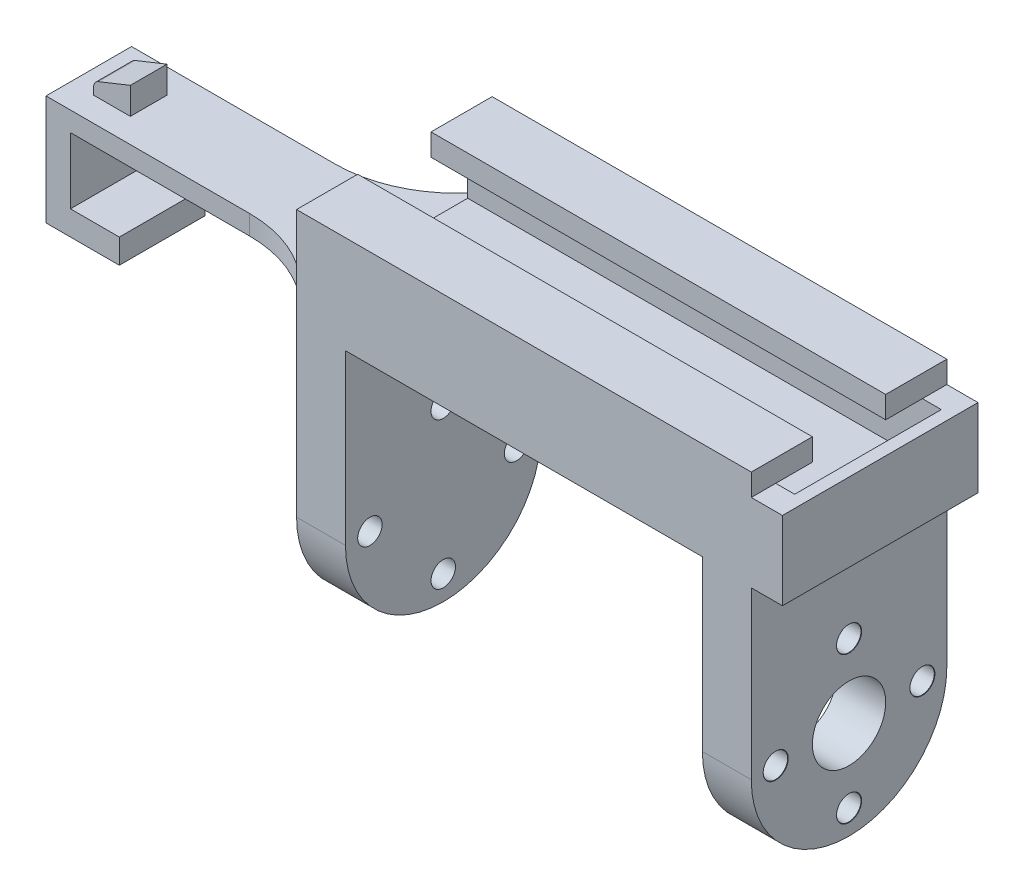
from build123d import *

# Parameters (mm, degrees)
BOSS_EXTRUDE1_DEPTH             = 8
BOSS_EXTRUDE1_DEPTH_BACK        = 8
M1_6_CLEARANCE_HOLE1_AT_2_COUNT = 2
M1_6_CLEARANCE_HOLE1_AT_2_PITCH = 8.485281374
M1_6_CLEARANCE_HOLE1_AT_3_COUNT = 2
M1_6_CLEARANCE_HOLE1_AT_3_PITCH = 12
M1_6_CLEARANCE_HOLE1_AT_4_COUNT = 2
M1_6_CLEARANCE_HOLE1_AT_4_PITCH = 8.485281374
CUT_EXTRUDE1_DEPTH              = 43.093229859
CUT_EXTRUDE1_DEPTH_BACK         = 43.093229859
CUT_EXTRUDE2_DEPTH              = 43.093229859
CUT_EXTRUDE2_DEPTH_BACK         = 43.093229859
SKETCH6_W                       = 6
SKETCH6_H                       = 1.8
SKETCH6_W_2                     = 12
SKETCH6_H_2                     = 4.4
BOSS_EXTRUDE2_START             = -0.5
SKETCH8_W                       = 23
SKETCH8_H                       = 7
BOSS_EXTRUDE2_DEPTH             = 1.6
BOSS_EXTRUDE3_DEPTH             = 7
BOSS_EXTRUDE4_DEPTH             = 1.55
SKETCH13_W                      = 16
SKETCH13_H                      = 6.4
BOSS_EXTRUDE5_DEPTH             = 1
BOSS_EXTRUDE6_DEPTH             = 1.5
BOSS_EXTRUDE6_DEPTH_BACK        = 1.5
FILLET1_R                       = 0.6
FILLET2_R                       = 10
FILLET3_R                       = 3
CUT_EXTRUDE3_DEPTH              = 66.244463379
CUT_EXTRUDE3_DEPTH_BACK         = 10
SKETCH16_R                      = 3


with BuildPart() as part:
    # Sketch1 → Boss-Extrude1 (new, two sides: drawn at the far end of the back side and taken through both)
    with BuildSketch(Plane.XY.offset(-BOSS_EXTRUDE1_DEPTH_BACK)):
        Polygon((18.6, 18), (-18.6, 18), (-18.6, -18), (-14.6, -18), (-14.6, 10), (14.6, 10), (14.6, -18), (18.6, -18), align=None)
    extrude(amount=BOSS_EXTRUDE1_DEPTH + BOSS_EXTRUDE1_DEPTH_BACK)

    # Sketch4 → M1.6 Clearance Hole1 (revolve, cut)
    with BuildSketch(Plane(origin=(18.6, -3.8, 6), x_dir=(0, 0, -1), z_dir=(0, 1, 0))):
        Polygon((0, 0), (0, 4.600860619), (1, 4), (1, 0.025), (1.025, 0), align=None)
    m1_6_clearance_hole1 = revolve(axis=Axis((24.95, -3.8, 6), (-1, 0, 0)), mode=Mode.SUBTRACT)

    # M1.6 Clearance Hole1 at 2: M1.6 Clearance Hole1 ×2
    with Locations(*[Vector(0, 0.7071067811865476, -0.7071067811865476) * (i * M1_6_CLEARANCE_HOLE1_AT_2_PITCH) for i in range(1, M1_6_CLEARANCE_HOLE1_AT_2_COUNT)]):
        add(m1_6_clearance_hole1, mode=Mode.SUBTRACT)

    # M1.6 Clearance Hole1 at 3: M1.6 Clearance Hole1 ×2
    with Locations(*[(0, 0, -i * M1_6_CLEARANCE_HOLE1_AT_3_PITCH) for i in range(1, M1_6_CLEARANCE_HOLE1_AT_3_COUNT)]):
        add(m1_6_clearance_hole1, mode=Mode.SUBTRACT)

    # M1.6 Clearance Hole1 at 4: M1.6 Clearance Hole1 ×2
    with Locations(*[Vector(0, -0.7071067811865475, -0.7071067811865476) * (i * M1_6_CLEARANCE_HOLE1_AT_4_PITCH) for i in range(1, M1_6_CLEARANCE_HOLE1_AT_4_COUNT)]):
        add(m1_6_clearance_hole1, mode=Mode.SUBTRACT)

    # Mirror1: M1.6 Clearance Hole1 across plane
    add(m1_6_clearance_hole1.mirror(Plane(origin=(0, 0, 0), x_dir=(0, 0, 1), z_dir=(1, 0, 0))), mode=Mode.SUBTRACT)

    # Mirror1 copy 1 sketch → Mirror1 copy 1 (revolve, cut)
    with BuildSketch(Plane(origin=(-18.6, 2.2, 0), x_dir=(0, 0, -1), z_dir=(0, 1, 0))):
        Polygon((0, 0), (0, -4.600860619), (1, -4), (1, -0.025), (1.025, 0), align=None)
    revolve(axis=Axis((-24.95, 2.2, 0), (-1, 0, 0)), mode=Mode.SUBTRACT)

    # Mirror1 copy 2 sketch → Mirror1 copy 2 (revolve, cut)
    with BuildSketch(Plane(origin=(-18.6, -3.8, -6), x_dir=(0, 0, -1), z_dir=(0, 1, 0))):
        Polygon((0, 0), (0, -4.600860619), (1, -4), (1, -0.025), (1.025, 0), align=None)
    revolve(axis=Axis((-24.95, -3.8, -6), (-1, 0, 0)), mode=Mode.SUBTRACT)

    # Mirror1 copy 3 sketch → Mirror1 copy 3 (revolve, cut)
    with BuildSketch(Plane(origin=(-18.6, -9.8, 0), x_dir=(0, 0, -1), z_dir=(0, 1, 0))):
        Polygon((0, 0), (0, -4.600860619), (1, -4), (1, -0.025), (1.025, 0), align=None)
    revolve(axis=Axis((-24.95, -9.8, 0), (-1, 0, 0)), mode=Mode.SUBTRACT)

    # Sketch5 → Cut-Extrude1 (cut, two sides: drawn at the far end of the back side and taken through both)
    with BuildSketch(Plane(origin=(18.6, 0, 0), x_dir=(0, 0, -1), z_dir=(1, 0, 0)).offset(-CUT_EXTRUDE1_DEPTH_BACK)):
        with BuildLine():
            Line((-8, -3.8), (-8, -18))
            Line((-8, -18), (8, -18))
            Line((8, -18), (8, -3.8))
            ThreePointArc((8, -3.8), (0, -11.8), (-8, -3.8))
        make_face()
    extrude(amount=CUT_EXTRUDE1_DEPTH + CUT_EXTRUDE1_DEPTH_BACK, mode=Mode.SUBTRACT)

    # Sketch6 → Cut-Extrude2 (cut, two sides: drawn at the far end of the back side and taken through both)
    with BuildSketch(Plane.ZY.offset(18.6).offset(-CUT_EXTRUDE2_DEPTH_BACK)):
        with Locations((0, 17.1)):
            Rectangle(SKETCH6_W, SKETCH6_H)
        with Locations((0, 14)):
            Rectangle(SKETCH6_W_2, SKETCH6_H_2)
    extrude(amount=CUT_EXTRUDE2_DEPTH + CUT_EXTRUDE2_DEPTH_BACK, mode=Mode.SUBTRACT)

    # Sketch8 → Boss-Extrude2 (add)
    with BuildSketch(Plane(origin=(0, 11.8, 0), x_dir=(1, 0, 0), z_dir=(0, 1, 0)).offset(BOSS_EXTRUDE2_START)):
        with Locations((-30.1, 0)):
            Rectangle(SKETCH8_W, SKETCH8_H)
    extrude(amount=-BOSS_EXTRUDE2_DEPTH)

    # Sketch10 → Boss-Extrude3 (add)
    with BuildSketch(Plane.XY.offset(3.5)):
        Polygon((-41.6, 11.3), (-43.6, 11.3), (-43.6, 2.3), (-37.6, 2.3), (-37.6, 4.3), (-41.6, 4.3), align=None)
    extrude(amount=-BOSS_EXTRUDE3_DEPTH)

    # Sketch12 → Boss-Extrude4 (add)
    with BuildSketch(Plane(origin=(18.6, 0, 0), x_dir=(0, 0, -1), z_dir=(1, 0, 0))):
        Polygon((6, 11.8), (6, 16.2), (8, 16.2), (8, 9.8), (-8, 9.8), (-8, 16.2), (-6, 16.2), (-6, 11.8), align=None)
    extrude(amount=BOSS_EXTRUDE4_DEPTH)

    # Sketch13 → Boss-Extrude5 (add)
    with BuildSketch(Plane(origin=(20.15, 0, 0), x_dir=(0, 0, -1), z_dir=(1, 0, 0))):
        with Locations((0, 13)):
            Rectangle(SKETCH13_W, SKETCH13_H)
    extrude(amount=BOSS_EXTRUDE5_DEPTH)

    # Sketch14 → Boss-Extrude6 (add, two sides: drawn at the far end of the back side and taken through both)
    with BuildSketch(Plane.XY.offset(-BOSS_EXTRUDE6_DEPTH_BACK)):
        Polygon((-41.7, 11.3), (-41.7, 12.3), (-38.7, 13.5), (-38.7, 11.3), align=None)
    extrude(amount=BOSS_EXTRUDE6_DEPTH + BOSS_EXTRUDE6_DEPTH_BACK)

    # Fillet1
    fillet1_edges = [part.edges().sort_by_distance(p)[0] for p in [
        (-41.7, 12.3, 0),
    ]]
    fillet(fillet1_edges, radius=FILLET1_R)

    # Fillet2
    # the kernel refuses this fillet: 10 mm, written as the material it adds along each edge
    with BuildSketch(Plane(origin=(-18.6, 11.3, -3.5), x_dir=(-1.5292458657399207e-12, 0, -1.0), z_dir=(0, -1, 0))) as fillet2_piece_1:
        with BuildLine():
            CenterArc((10, -8.351646544), FILLET2_R, 123.367012969, 56.632987031)
            Line((0, -8.351646544), (0, 0))
            Line((0, 0), (4.5, 0))
        make_face()
    extrude(amount=1.6)
    with BuildSketch(Plane(origin=(-18.6, 11.3, 3.5), x_dir=(-1, 0, 0), z_dir=(0, -1, 0))) as fillet2_piece_2:
        with BuildLine():
            CenterArc((8.351646544, -10), FILLET2_R, 90, 56.632987031)
            Line((0, -4.5), (0, 0))
            Line((0, 0), (8.351646544, 0))
        make_face()
    extrude(amount=1.6)

    # Fillet3
    # the kernel refuses this fillet: 3 mm, written as the material it adds along each edge
    with BuildSketch(Plane(origin=(-18.6, 9.7, 3.5), x_dir=(-1, 0, 0), z_dir=(0, 0, -1))) as fillet3_piece_1:
        with BuildLine():
            CenterArc((FILLET3_R, -FILLET3_R), FILLET3_R, 90, 90)
            Line((0, -FILLET3_R), (0, 0))
            Line((0, 0), (FILLET3_R, 0))
        make_face()
    extrude(amount=7)
    with BuildSketch(Plane(origin=(-18.6, 9.7, 8), x_dir=(-1.0, 0, -1.5555555555538275e-12), z_dir=(1.5555555555538273e-12, 0, -1.0))) as fillet3_piece_2_section:
        with BuildLine():
            CenterArc((FILLET3_R, -FILLET3_R), FILLET3_R, 90, 90)
            Line((0, -FILLET3_R), (0, 0))
            Line((0, 0), (FILLET3_R, 0))
        make_face()
    fillet3_piece_2 = extrude(amount=4.5, mode=Mode.PRIVATE)
    fillet3_piece_2 = fillet3_piece_2 - Plane(origin=(-26.951646544, 8.943750406, 13.5), x_dir=(-1, 0, 0), z_dir=(0, 1, 0)) * Cylinder(10, 22, mode=Mode.PRIVATE)
    add(fillet3_piece_2)
    with BuildSketch(Plane(origin=(-18.6, 9.7, -3.5), x_dir=(-1.0, 0, 2e-12), z_dir=(-2e-12, 0, -1.0))) as fillet3_piece_3_section:
        with BuildLine():
            CenterArc((FILLET3_R, -FILLET3_R), FILLET3_R, 90, 90)
            Line((0, -FILLET3_R), (0, 0))
            Line((0, 0), (FILLET3_R, 0))
        make_face()
    fillet3_piece_3 = extrude(amount=4.5, mode=Mode.PRIVATE)
    fillet3_piece_3 = fillet3_piece_3 - Plane(origin=(-26.951646544, 8.943748833, -13.5), x_dir=(-2e-12, 0, -1.0), z_dir=(0, 1, 0)) * Cylinder(10, 22, mode=Mode.PRIVATE)
    add(fillet3_piece_3)

    # Sketch16 → Cut-Extrude3 (cut, two sides: drawn at the far end of the back side and taken through both)
    with BuildSketch(Plane(origin=(18.6, 0, 0), x_dir=(0, 0, -1), z_dir=(1, 0, 0)).offset(-CUT_EXTRUDE3_DEPTH_BACK)):
        with Locations(Location((0, -3.8, 0), (0, 0, 180))):
            Circle(SKETCH16_R)
    extrude(amount=CUT_EXTRUDE3_DEPTH + CUT_EXTRUDE3_DEPTH_BACK, mode=Mode.SUBTRACT)


solid = part.part
